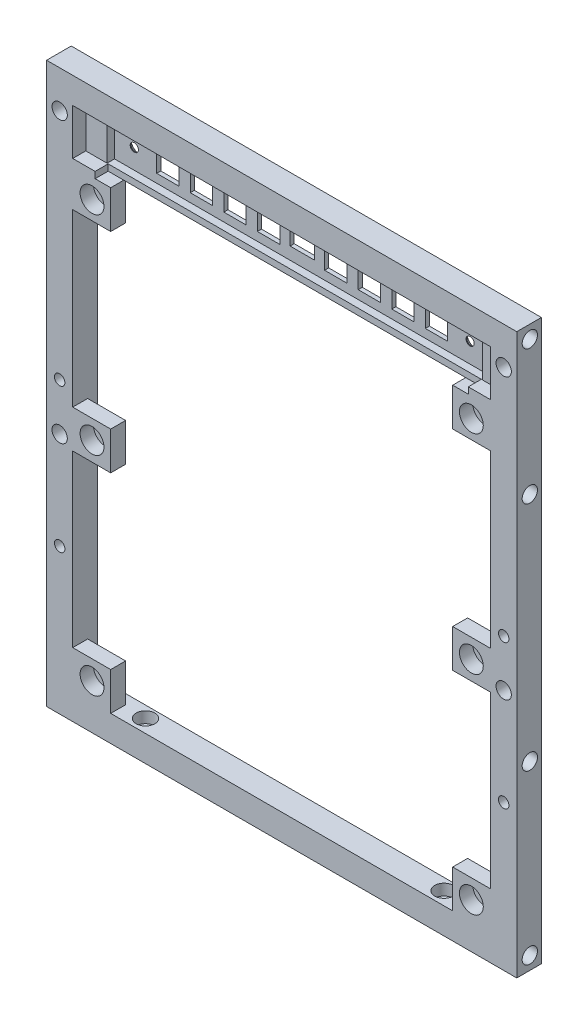
from build123d import *
from build123d.topology import SkipClean

# Parameters (mm, degrees)
SKETCH1_W                = 126
SKETCH1_H                = 150
SKETCH1_W_2              = 112
SKETCH1_H_2              = 136
BOSS_EXTRUDE1_DEPTH      = 7
SKETCH2_R                = 2.05
CUT_EXTRUDE1_DEPTH       = 6
SKETCH3_R                = 1.35
CUT_EXTRUDE2_DEPTH       = 157.419308271
SKETCH4_R                = 2.5
CUT_EXTRUDE3_DEPTH       = 3
SKETCH5_R                = 1.4
CUT_EXTRUDE4_DEPTH       = 99.198777996
SKETCH6_R                = 2.5
CUT_EXTRUDE5_DEPTH       = 3
SKETCH7_R                = 2.05
CUT_EXTRUDE6_DEPTH       = 99.198777996
CUT_EXTRUDE7_DEPTH       = 0.2
SKETCH9_W                = 2.8
SKETCH9_H                = 2.8
CUT_EXTRUDE8_DEPTH       = 0.2
SKETCH10_W               = 6
SKETCH10_H               = 6
BOSS_EXTRUDE2_DEPTH      = 5.5
SKETCH11_R               = 1.65
CUT_EXTRUDE9_DEPTH       = 99.103261923
SKETCH12_W               = 112
SKETCH12_H               = 14
BOSS_EXTRUDE3_DEPTH      = 1.5
SKETCH13_W               = 112
SKETCH13_H               = 14
SKETCH13_W_2             = 100.6
SKETCH13_H_2             = 10.6
BOSS_EXTRUDE4_DEPTH      = 2
SKETCH14_W               = 6
SKETCH14_H               = 6
SKETCH14_W_2             = 6.5
SKETCH14_H_2             = 4
CUT_EXTRUDE10_DEPTH      = 99.103261923
SKETCH15_R               = 1
BOSS_EXTRUDE5_DEPTH      = 2
CHAMFER2_SIZE            = 0.4
CHAMFER3_SIZE            = 0.4
SKETCH16_W               = 6
SKETCH16_H               = 6
BOSS_EXTRUDE7_DEPTH      = 5.5
SKETCH17_R               = 1.65
CUT_EXTRUDE11_DEPTH      = 99.103261923
CUT_EXTRUDE12_DEPTH      = 99.103261923
CUT_EXTRUDE12_DEPTH_BACK = 99.103261923
SKETCH18_R               = 1.1
CHAMFER4_SIZE            = 1.3
SKETCH19_W               = 112
SKETCH19_H               = 122
CUT_EXTRUDE13_DEPTH      = 99.103261923
SKETCH20_W               = 8
SKETCH20_H               = 8
BOSS_EXTRUDE8_DEPTH      = 7
SKETCH21_R               = 2.1
CUT_EXTRUDE14_DEPTH      = 99.198777996
CHAMFER5_SIZE            = 3
SKETCH22_W               = 112
SKETCH22_H               = 122
CUT_EXTRUDE15_DEPTH      = 10
CUT_EXTRUDE16_DEPTH      = 142.017729382
CUT_EXTRUDE16_DEPTH_BACK = 142.017729382
SKETCH23_W               = 3
SKETCH23_H               = 122
SKETCH25_W               = 10.175
SKETCH25_H               = 10.175
BOSS_EXTRUDE9_DEPTH      = 4
SKETCH26_R               = 3.2
CUT_EXTRUDE17_DEPTH      = 3.6


with BuildPart() as part:
    # Sketch1 → Boss-Extrude1 (new body)
    with BuildSketch(Plane.XY):
        Rectangle(SKETCH1_W, SKETCH1_H)
        Rectangle(SKETCH1_W_2, SKETCH1_H_2, mode=Mode.SUBTRACT)
    extrude(amount=BOSS_EXTRUDE1_DEPTH)

    # Sketch2 → Cut-Extrude1 (cut)
    with BuildSketch(Plane.ZY.offset(63)):
        with Locations((3.5, -71.5)):
            Circle(SKETCH2_R)
        with Locations((3.5, 71.5)):
            Circle(SKETCH2_R)
        with Locations((3.5, 35.5)):
            Circle(SKETCH2_R)
        with Locations((3.5, -26.5)):
            Circle(SKETCH2_R)
    cut_extrude1 = extrude(amount=-CUT_EXTRUDE1_DEPTH, mode=Mode.SUBTRACT)

    # Mirror1: Cut-Extrude1 across plane
    add(cut_extrude1.mirror(Plane(origin=(0, 0, 0), x_dir=(0, 0, 1), z_dir=(1, 0, 0))), mode=Mode.SUBTRACT)

    # Sketch3 → Cut-Extrude2 (cut, through all)
    with BuildSketch(Plane(origin=(0, -68, 0), x_dir=(1, 0, 0), z_dir=(0, 1, 0))):
        with Locations(Location((40, -3.5, 0), (0, 0, 270))):
            Circle(SKETCH3_R)
        with Locations(Location((-40, -3.5, 0), (0, 0, 270))):
            Circle(SKETCH3_R)
    extrude(amount=-CUT_EXTRUDE2_DEPTH, mode=Mode.SUBTRACT)

    # Sketch4 → Cut-Extrude3 (cut)
    with BuildSketch(Plane(origin=(0, -68, 0), x_dir=(1, 0, 0), z_dir=(0, 1, 0))):
        with Locations(Location((40, -3.5, 0), (0, 0, 270))):
            Circle(SKETCH4_R)
        with Locations(Location((-40, -3.5, 0), (0, 0, 270))):
            Circle(SKETCH4_R)
    extrude(amount=-CUT_EXTRUDE3_DEPTH, mode=Mode.SUBTRACT)

    # Sketch5 → Cut-Extrude4 (cut, through all)
    with BuildSketch(Plane(origin=(0, 0, 0), x_dir=(-1, 0, 0), z_dir=(0, 0, -1))):
        with Locations((-59.5, 2.6)):
            Circle(SKETCH5_R)
        with Locations(Location((59.5, 2.6, 0), (0, 0, 180))):
            Circle(SKETCH5_R)
        with Locations((-59.5, -36)):
            Circle(SKETCH5_R)
        with Locations(Location((59.5, -36, 0), (0, 0, 180))):
            Circle(SKETCH5_R)
    extrude(amount=-CUT_EXTRUDE4_DEPTH, mode=Mode.SUBTRACT)

    # Sketch6 → Cut-Extrude5 (cut)
    with BuildSketch(Plane(origin=(0, 0, 0), x_dir=(-1, 0, 0), z_dir=(0, 0, -1))):
        with Locations((-59.5, 2.6)):
            Circle(SKETCH6_R)
        with Locations((59.5, 2.6)):
            Circle(SKETCH6_R)
        with Locations((-59.5, -36)):
            Circle(SKETCH6_R)
        with Locations((59.5, -36)):
            Circle(SKETCH6_R)
    extrude(amount=-CUT_EXTRUDE5_DEPTH, mode=Mode.SUBTRACT)

    # Sketch7 → Cut-Extrude6 (cut, through all)
    with BuildSketch(Plane(origin=(0, 0, 0), x_dir=(-1, 0, 0), z_dir=(0, 0, -1))):
        with Locations((-59.5, 65)):
            Circle(SKETCH7_R)
        with Locations((-59.5, -10)):
            Circle(SKETCH7_R)
    cut_extrude6 = extrude(amount=-CUT_EXTRUDE6_DEPTH, mode=Mode.SUBTRACT)

    # Mirror2: Cut-Extrude6 across plane
    add(cut_extrude6.mirror(Plane(origin=(0, 0, 0), x_dir=(0, 0, 1), z_dir=(1, 0, 0))), mode=Mode.SUBTRACT)

    # Sketch8 → Cut-Extrude7 (cut)
    with SkipClean():  # the faces are left unmerged after this step: merging them gives an invalid solid
        with BuildSketch(Plane(origin=(0, 0, 3), x_dir=(-1, 0, 0), z_dir=(0, 0, -1))):
            with BuildLine():
                Line((-60.9, 0.528768482), (-60.9, 4.671231518))
                ThreePointArc((-60.9, 4.671231518), (-59.5, 5.1), (-58.1, 4.671231518))
                Line((-58.1, 4.671231518), (-58.1, 0.528768482))
                ThreePointArc((-58.1, 0.528768482), (-59.5, 0.1), (-60.9, 0.528768482))
            make_face()
            with BuildLine():
                Line((-60.9, -38.071231518), (-60.9, -33.928768482))
                ThreePointArc((-60.9, -33.928768482), (-59.5, -33.5), (-58.1, -33.928768482))
                Line((-58.1, -33.928768482), (-58.1, -38.071231518))
                ThreePointArc((-58.1, -38.071231518), (-59.5, -38.5), (-60.9, -38.071231518))
            make_face()
        cut_extrude7 = extrude(amount=-CUT_EXTRUDE7_DEPTH, mode=Mode.SUBTRACT)

    # Sketch9 → Cut-Extrude8 (cut)
    with SkipClean():  # the faces are left unmerged after this step: merging them gives an invalid solid
        with BuildSketch(Plane(origin=(0, 0, 3.2), x_dir=(-1, 0, 0), z_dir=(0, 0, -1))):
            with Locations((-59.5, 2.6)):
                Rectangle(SKETCH9_W, SKETCH9_H)
            with Locations((-59.5, -36)):
                Rectangle(SKETCH9_W, SKETCH9_H)
        cut_extrude8 = extrude(amount=-CUT_EXTRUDE8_DEPTH, mode=Mode.SUBTRACT)

    # Mirror3: Cut-Extrude7, Cut-Extrude8 across plane
    with SkipClean():  # the faces are left unmerged after this step: merging them gives an invalid solid
        add(cut_extrude7.mirror(Plane(origin=(0, 0, 0), x_dir=(0, 0, 1), z_dir=(1, 0, 0))), mode=Mode.SUBTRACT)
        add(cut_extrude8.mirror(Plane(origin=(0, 0, 0), x_dir=(0, 0, 1), z_dir=(1, 0, 0))), mode=Mode.SUBTRACT)

    # Sketch10 → Boss-Extrude2 (add)
    with SkipClean():  # the faces are left unmerged after this step: merging them gives an invalid solid
        with BuildSketch(Plane.XY.offset(7)):
            with Locations((53, -65)):
                Rectangle(SKETCH10_W, SKETCH10_H)
            with Locations((53, -35.5)):
                Rectangle(SKETCH10_W, SKETCH10_H)
        boss_extrude2 = extrude(amount=-BOSS_EXTRUDE2_DEPTH)

    # Sketch11 → Cut-Extrude9 (cut, through all)
    with SkipClean():  # the faces are left unmerged after this step: merging them gives an invalid solid
        with BuildSketch(Plane(origin=(0, 0, 1.5), x_dir=(-1, 0, 0), z_dir=(0, 0, -1))):
            with Locations((-53, -35.5)):
                Circle(SKETCH11_R)
            with Locations((-53, -65)):
                Circle(SKETCH11_R)
        cut_extrude9 = extrude(amount=-CUT_EXTRUDE9_DEPTH, mode=Mode.SUBTRACT)

    # Mirror4: Boss-Extrude2, Cut-Extrude9 across plane
    with SkipClean():  # the faces are left unmerged after this step: merging them gives an invalid solid
        add(boss_extrude2.mirror(Plane(origin=(0, 0, 0), x_dir=(0, 0, 1), z_dir=(1, 0, 0))))
        add(cut_extrude9.mirror(Plane(origin=(0, 0, 0), x_dir=(0, 0, 1), z_dir=(1, 0, 0))), mode=Mode.SUBTRACT)

    # Sketch12 → Boss-Extrude3 (add)
    with SkipClean():  # the faces are left unmerged after this step: merging them gives an invalid solid
        with BuildSketch(Plane(origin=(0, 0, 0), x_dir=(-1, 0, 0), z_dir=(0, 0, -1))):
            with Locations((0, 61)):
                Rectangle(SKETCH12_W, SKETCH12_H)
        extrude(amount=-BOSS_EXTRUDE3_DEPTH)

    # Sketch13 → Boss-Extrude4 (add)
    with SkipClean():  # the faces are left unmerged after this step: merging them gives an invalid solid
        with BuildSketch(Plane.XY.offset(1.5)):
            with Locations((0, 61)):
                Rectangle(SKETCH13_W, SKETCH13_H)
            with Locations((0, 61)):
                Rectangle(SKETCH13_W_2, SKETCH13_H_2, mode=Mode.SUBTRACT)
        extrude(amount=BOSS_EXTRUDE4_DEPTH)

    # Sketch14 → Cut-Extrude10 (cut, through all)
    with SkipClean():  # the faces are left unmerged after this step: merging them gives an invalid solid
        with BuildSketch(Plane.XY.offset(1.5)):
            with Locations((-36, 61)):
                Rectangle(SKETCH14_W, SKETCH14_H)
            with Locations((0, 61)):
                Rectangle(SKETCH14_W_2, SKETCH14_H_2)
            with Locations((9, 61)):
                Rectangle(SKETCH14_W, SKETCH14_H)
            with Locations((18, 61)):
                Rectangle(SKETCH14_W, SKETCH14_H)
            with Locations((27, 61)):
                Rectangle(SKETCH14_W, SKETCH14_H)
            with Locations((36, 61)):
                Rectangle(SKETCH14_W, SKETCH14_H)
            with Locations((-27, 61)):
                Rectangle(SKETCH14_W, SKETCH14_H)
            with Locations((-18, 61)):
                Rectangle(SKETCH14_W, SKETCH14_H)
            with Locations((-9, 61)):
                Rectangle(SKETCH14_W, SKETCH14_H)
        extrude(amount=-CUT_EXTRUDE10_DEPTH, mode=Mode.SUBTRACT)

    # Sketch15 → Boss-Extrude5 (add)
    with SkipClean():  # the faces are left unmerged after this step: merging them gives an invalid solid
        with BuildSketch(Plane.XY.offset(1.5)):
            with Locations(Location((-45, 61, 0), (0, 0, 180))):
                Circle(SKETCH15_R)
            with Locations(Location((45, 61, 0), (0, 0, 180))):
                Circle(SKETCH15_R)
        extrude(amount=BOSS_EXTRUDE5_DEPTH)

    # Chamfer1: read off the stored shape, not the designer's step
    # Chamfer1: loft between two sections, ruled curve by curve
    with SkipClean():  # the faces are left unmerged after this step: merging them gives an invalid solid
        chamfer1_from = [
            Edge.make_line((-56, 54, 0.4), (-56, -68, 0.4)),
            Edge.make_line((-56, -68, 0.4), (56, -68, 0.4)),
            Edge.make_line((56, -68, 0.4), (56, 54, 0.4)),
            Edge.make_line((56, 54, 0.4), (-56, 54, 0.4)),
        ]
        chamfer1_to = [
            Edge.make_line((-56.4, 54, 0), (-56.4, -68.4, 0)),
            Edge.make_line((-56.4, -68.4, 0), (56.4, -68.4, 0)),
            Edge.make_line((56.4, -68.4, 0), (56.4, 54, 0)),
            Edge.make_line((56.4, 54, 0), (-56.4, 54, 0)),
        ]
        chamfer1 = Solid(Shell([*[Face.make_surface_from_curves(chamfer1_from[k], chamfer1_to[k]) for k in range(4)], Face(Wire(chamfer1_from)), Face(Wire(chamfer1_to))]))
        add(chamfer1, mode=Mode.SUBTRACT)

    # Chamfer2
    chamfer2_edges = [part.edges().sort_by_distance(p)[0] for p in [
        (0, -75, 0),
        (-63, 0, 0),
        (0, 75, 0),
        (63, 0, 0),
    ]]
    chamfer(chamfer2_edges, length=CHAMFER2_SIZE)

    # Chamfer3
    chamfer3_edges = [part.edges().sort_by_distance(p)[0] for p in [
        (-6, 61, 0),
        (-9, 58, 0),
        (-12, 61, 0),
        (-9, 64, 0),
        (-15, 61, 0),
        (-18, 58, 0),
        (-21, 61, 0),
        (-18, 64, 0),
        (-24, 61, 0),
        (-27, 58, 0),
        (-30, 61, 0),
        (-27, 64, 0),
        (-33, 61, 0),
        (-36, 58, 0),
        (-39, 61, 0),
        (-36, 64, 0),
        (39, 61, 0),
        (36, 58, 0),
        (33, 61, 0),
        (36, 64, 0),
        (30, 61, 0),
        (27, 58, 0),
        (24, 61, 0),
        (27, 64, 0),
        (21, 61, 0),
        (18, 58, 0),
        (15, 61, 0),
        (18, 64, 0),
        (12, 61, 0),
        (9, 58, 0),
        (6, 61, 0),
        (9, 64, 0),
        (3.25, 61, 0),
        (0, 59, 0),
        (-3.25, 61, 0),
        (0, 63, 0),
    ]]
    chamfer(chamfer3_edges, length=CHAMFER3_SIZE)

    # Sketch16 → Boss-Extrude7 (add)
    with SkipClean():  # the faces are left unmerged after this step: merging them gives an invalid solid
        with BuildSketch(Plane.XY.offset(7)):
            Polygon((-50, 54), (-50, 55.7), (-56, 55.7), (-56, 54), (-56, 48), (-50, 48), align=None)
            with Locations((-53, -29.5)):
                Rectangle(SKETCH16_W, SKETCH16_H)
            with Locations((53, -29.5)):
                Rectangle(SKETCH16_W, SKETCH16_H)
            Polygon((56, 54), (56, 48), (50, 48), (50, 54), (50, 55.7), (56, 55.7), align=None)
        extrude(amount=-BOSS_EXTRUDE7_DEPTH)

    # Sketch17 → Cut-Extrude11 (cut, through all)
    with SkipClean():  # the faces are left unmerged after this step: merging them gives an invalid solid
        with BuildSketch(Plane(origin=(0, 0, 1.5), x_dir=(-1, 0, 0), z_dir=(0, 0, -1))):
            with Locations((-53, -29.5)):
                Circle(SKETCH17_R)
            with Locations((53, -29.5)):
                Circle(SKETCH17_R)
            with Locations((53, 51)):
                Circle(SKETCH17_R)
            with Locations((-53, 51)):
                Circle(SKETCH17_R)
        extrude(amount=-CUT_EXTRUDE11_DEPTH, mode=Mode.SUBTRACT)

    # Sketch18 → Cut-Extrude12 (cut, two sides: drawn at the far end of the back side and taken through both)
    with SkipClean():  # the faces are left unmerged after this step: merging them gives an invalid solid
        with BuildSketch(Plane.XY.offset(1.5).offset(-CUT_EXTRUDE12_DEPTH_BACK)):
            with Locations((-45, 61)):
                Circle(SKETCH18_R)
            with Locations((45, 61)):
                Circle(SKETCH18_R)
        extrude(amount=CUT_EXTRUDE12_DEPTH + CUT_EXTRUDE12_DEPTH_BACK, mode=Mode.SUBTRACT)

    # Chamfer4
    chamfer4_edges = [part.edges().sort_by_distance(p)[0] for p in [
        (-46.1, 61, 0),
        (43.9, 61, 0),
    ]]
    chamfer(chamfer4_edges, length=CHAMFER4_SIZE)

    # Sketch19 → Cut-Extrude13 (cut, through all)
    with SkipClean():  # the faces are left unmerged after this step: merging them gives an invalid solid
        with BuildSketch(Plane(origin=(0, 0, 1.5), x_dir=(-1, 0, 0), z_dir=(0, 0, -1))):
            with Locations((0, -7)):
                Rectangle(SKETCH19_W, SKETCH19_H)
        extrude(amount=-CUT_EXTRUDE13_DEPTH, mode=Mode.SUBTRACT)

    # Sketch20 → Boss-Extrude8 (add)
    with SkipClean():  # the faces are left unmerged after this step: merging them gives an invalid solid
        with BuildSketch(Plane.XY.offset(3)):
            with Locations((52, -64)):
                Rectangle(SKETCH20_W, SKETCH20_H)
            with Locations((52, 50)):
                Rectangle(SKETCH20_W, SKETCH20_H)
            with Locations((52, -28.5)):
                Rectangle(SKETCH20_W, SKETCH20_H)
        boss_extrude8 = extrude(amount=BOSS_EXTRUDE8_DEPTH)

    # Sketch21 → Cut-Extrude14 (cut, through all)
    with SkipClean():  # the faces are left unmerged after this step: merging them gives an invalid solid
        with BuildSketch(Plane(origin=(0, 0, 3), x_dir=(-1, 0, 0), z_dir=(0, 0, -1))):
            with Locations((-52, 50)):
                Circle(SKETCH21_R)
            with Locations((-52, -64)):
                Circle(SKETCH21_R)
            with Locations((-52, -28.5)):
                Circle(SKETCH21_R)
        cut_extrude14 = extrude(amount=-CUT_EXTRUDE14_DEPTH, mode=Mode.SUBTRACT)

    # Mirror5: Boss-Extrude8, Cut-Extrude14 across plane
    with SkipClean():  # the faces are left unmerged after this step: merging them gives an invalid solid
        add(boss_extrude8.mirror(Plane(origin=(0, 0, 0), x_dir=(0, 0, 1), z_dir=(1, 0, 0))))
        add(cut_extrude14.mirror(Plane(origin=(0, 0, 0), x_dir=(0, 0, 1), z_dir=(1, 0, 0))), mode=Mode.SUBTRACT)

    # Chamfer5
    # the kernel refuses this chamfer: 3 mm, written as the material it adds along each edge
    with BuildSketch(Plane(origin=(-56, -62, 7), x_dir=(-1, 0, 0), z_dir=(0, -1, 0)), Plane(origin=(56, -68, 7), x_dir=(1, 0, 0), z_dir=(0, 1, 0)), Plane(origin=(-56, -26.5, 7), x_dir=(-1, 0, 0), z_dir=(0, -1, 0)), Plane(origin=(56, -32.5, 7), x_dir=(1, 0, 0), z_dir=(0, 1, 0))) as chamfer5_piece_1:
        Polygon((CHAMFER5_SIZE, 0), (0, -CHAMFER5_SIZE), (0, 0), align=None)
    extrude(amount=6)
    with BuildSketch(Plane(origin=(56, 54, 7), x_dir=(1, 0, 0), z_dir=(0, -1, 0)), Plane(origin=(-56, 48, 7), x_dir=(-1, 0, 0), z_dir=(0, 1, 0))) as chamfer5_piece_2:
        Polygon((CHAMFER5_SIZE, 0), (0, CHAMFER5_SIZE), (0, 0), align=None)
    extrude(amount=6)
    with BuildSketch(Plane(origin=(56, -26.5, 7), x_dir=(1, 0, 0), z_dir=(0, 1, 0)), Plane(origin=(-56, -24.5, 7), x_dir=(-1, 0, 0), z_dir=(0, -1, 0)), Plane(origin=(-56, 48, 7), x_dir=(-1, 0, 0), z_dir=(0, -1, 0)), Plane(origin=(56, 46, 7), x_dir=(1, 0, 0), z_dir=(0, 1, 0)), Plane(origin=(56, -62, 7), x_dir=(1, 0, 0), z_dir=(0, 1, 0)), Plane(origin=(-56, -60, 7), x_dir=(-1, 0, 0), z_dir=(0, -1, 0))) as chamfer5_piece_3:
        Polygon((CHAMFER5_SIZE, 0), (0, -CHAMFER5_SIZE), (0, 0), align=None)
    extrude(amount=2)

    # Sketch22 → Cut-Extrude15 (cut)
    with BuildSketch(Plane(origin=(0, 0, 3), x_dir=(-1, 0, 0), z_dir=(0, 0, -1))):
        with Locations((0, -7)):
            Rectangle(SKETCH22_W, SKETCH22_H)
    extrude(amount=-CUT_EXTRUDE15_DEPTH, mode=Mode.SUBTRACT)

    # Sketch23 → Cut-Extrude16 (cut, two sides: drawn at the far end of the back side and taken through both)
    with BuildSketch(Plane(origin=(-56, 0, 0), x_dir=(0, 0, -1), z_dir=(1, 0, 0)).offset(-CUT_EXTRUDE16_DEPTH_BACK)):
        with Locations((-8.5, -7)):
            Rectangle(SKETCH23_W, SKETCH23_H)
    extrude(amount=CUT_EXTRUDE16_DEPTH + CUT_EXTRUDE16_DEPTH_BACK, mode=Mode.SUBTRACT)

    # Sketch25 → Boss-Extrude9 (add)
    with BuildSketch(Plane.XY.offset(3)):
        with Locations((-50.9125, 48.9125)):
            Rectangle(SKETCH25_W, SKETCH25_H)
        with Locations((-50.9125, -7.1)):
            Rectangle(SKETCH25_W, SKETCH25_H)
        with Locations((-50.9125, -62.9125)):
            Rectangle(SKETCH25_W, SKETCH25_H)
        with Locations((50.9125, -62.9125)):
            Rectangle(SKETCH25_W, SKETCH25_H)
        with Locations((50.9125, -7.1)):
            Rectangle(SKETCH25_W, SKETCH25_H)
        with Locations((50.9125, 48.9125)):
            Rectangle(SKETCH25_W, SKETCH25_H)
    extrude(amount=BOSS_EXTRUDE9_DEPTH)

    # Sketch26 → Cut-Extrude17 (cut)
    with BuildSketch(Plane.XY.offset(7)):
        with Locations((-50.825, -7.1)):
            Circle(SKETCH26_R)
        with Locations((-50.825, -62.95)):
            Circle(SKETCH26_R)
        with Locations((50.825, -62.95)):
            Circle(SKETCH26_R)
        with Locations((50.825, -7.1)):
            Circle(SKETCH26_R)
        with Locations((50.825, 48.75)):
            Circle(SKETCH26_R)
        with Locations((-50.825, 48.75)):
            Circle(SKETCH26_R)
    extrude(amount=-CUT_EXTRUDE17_DEPTH, mode=Mode.SUBTRACT)


solid = part.part
